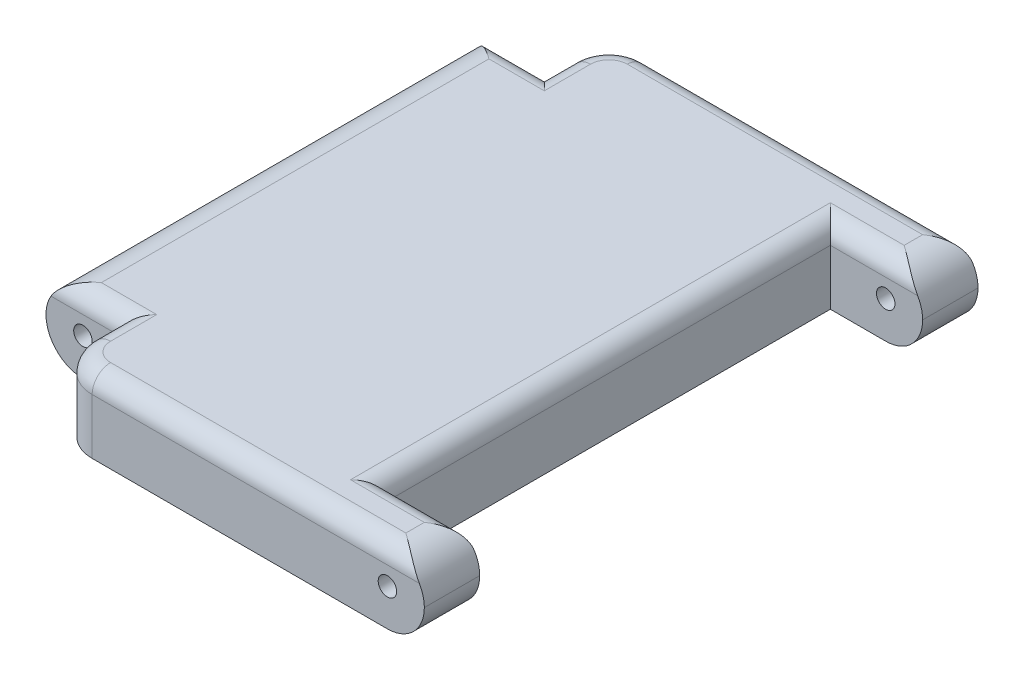
from build123d import *

# Parameters (mm, degrees)
EXTRUDE_1_DEPTH          = 4
CUT_EXTRUDE_1_DEPTH      = 31.6757233
CUT_EXTRUDE_1_DEPTH_BACK = 31.6757233
SKETCH_2_R               = 0.5
CUT_EXTRUDE_2_REACH      = 32.237
SKETCH_3_R               = 0.5
FILLET_1_R               = 2
FILLET_2_R               = 1


# Some blends are built 0.0001 mm under size
with BuildPart() as part:
    # Эскиз1 → Бобышка-Вытянуть1 (new body)
    with BuildSketch(Plane(origin=(0, 0, 0), x_dir=(1, 0, 0), z_dir=(0, 1, 0))):
        Polygon((-10, 15), (10, 15), (10, 12), (5, 12), (5, -12), (10, -12), (10, -15), (-10, -15), (-10, -11.5), (-14, -11.5), (-14, 11.5), (-10, 11.5), align=None)
    extrude(amount=EXTRUDE_1_DEPTH)

    # Эскиз2 → Вырез-Вытянуть1 (cut, two sides: drawn at the far end of the back side and taken through both)
    with BuildSketch(Plane.XY.offset(-12).offset(-CUT_EXTRUDE_1_DEPTH_BACK)):
        with Locations((8, 2)):
            Circle(SKETCH_2_R)
    extrude(amount=CUT_EXTRUDE_1_DEPTH + CUT_EXTRUDE_1_DEPTH_BACK, mode=Mode.SUBTRACT)

    # Эскиз3 → Вырез-Вытянуть2 (cut, up to next)
    with BuildSketch(Plane.XY.offset(11.5), mode=Mode.PRIVATE) as cut_extrude_2_sk1:
        with Locations((-12, 2)):
            Circle(SKETCH_3_R)
    cut_extrude_2_tool1 = extrude(cut_extrude_2_sk1.sketch, amount=-CUT_EXTRUDE_2_REACH, mode=Mode.PRIVATE) & part.part
    add(cut_extrude_2_tool1.solids().sort_by_distance((-12, 2, 11.5))[0], mode=Mode.SUBTRACT)

    # Скругление1
    fillet_1_edges = [part.edges().sort_by_distance(p)[0] for p in [
        (10, 0, -13.5),
        (10, 4, -13.5),
        (10, 0, 13.5),
        (10, 4, 13.5),
        (-14, 0, 0),
        (-14, 4, 0),
        (-10, 2, -15),
        (-10, 2, 15),
    ]]
    fillet(fillet_1_edges, radius=FILLET_1_R - 0.0001)  # a hair under: the kernel refuses the full size

    # Скругление2
    # the kernel refuses this fillet: 1 mm, written as the material it takes off along each edge
    with BuildSketch(Plane(origin=(5, 4, -12), x_dir=(-1, 0, 0), z_dir=(0, 0, 1))) as fillet_2_piece_1:
        with BuildLine():
            CenterArc((FILLET_2_R, FILLET_2_R), FILLET_2_R, 180, 90)
            Line((0, FILLET_2_R), (0, 0))
            Line((0, 0), (FILLET_2_R, 0))
        make_face()
    extrude(amount=24, mode=Mode.SUBTRACT)
    with BuildSketch(Plane(origin=(10.5001, 4, -12), x_dir=(0, 0, -1), z_dir=(-1, 0, 0)), Plane(origin=(5, 4, 12), x_dir=(0, 0, 1), z_dir=(1, 0, 0))) as fillet_2_piece_2:
        with BuildLine():
            CenterArc((FILLET_2_R, FILLET_2_R), FILLET_2_R, 180, 90)
            Line((0, FILLET_2_R), (0, 0))
            Line((0, 0), (FILLET_2_R, 0))
        make_face()
    extrude(amount=5.5001, mode=Mode.SUBTRACT)
    with BuildSketch(Plane(origin=(-14.5001, 4, -11.5), x_dir=(0, 0, 1), z_dir=(1, 0, 0)), Plane(origin=(-10, 4, 11.5), x_dir=(0, 0, -1), z_dir=(-1, 0, 0))) as fillet_2_piece_3:
        with BuildLine():
            CenterArc((FILLET_2_R, FILLET_2_R), FILLET_2_R, 180, 90)
            Line((0, FILLET_2_R), (0, 0))
            Line((0, 0), (FILLET_2_R, 0))
        make_face()
    extrude(amount=4.5001, mode=Mode.SUBTRACT)
    with BuildSketch(Plane(origin=(-10, 4, 13.0001), x_dir=(1, 0, 0), z_dir=(0, 0, -1)), Plane(origin=(-10, 4, -11.5), x_dir=(1, 0, 0), z_dir=(0, 0, -1))) as fillet_2_piece_4:
        with BuildLine():
            CenterArc((FILLET_2_R, FILLET_2_R), FILLET_2_R, 180, 90)
            Line((0, FILLET_2_R), (0, 0))
            Line((0, 0), (FILLET_2_R, 0))
        make_face()
    extrude(amount=1.5001, mode=Mode.SUBTRACT)
    with BuildSketch(Plane(origin=(-8.0001, 4, -15), x_dir=(0, -1, 0), z_dir=(1, 0, 0))) as fillet_2_piece_5:
        with BuildLine():
            CenterArc((FILLET_2_R, -FILLET_2_R), FILLET_2_R, 90, 90)
            Line((0, -FILLET_2_R), (0, 0))
            Line((0, 0), (FILLET_2_R, 0))
        make_face()
    extrude(amount=18.5002, mode=Mode.SUBTRACT)
    with BuildSketch(Plane(origin=(10.5001, 4, 15), x_dir=(0, 0, -1), z_dir=(-1, 0, 0))) as fillet_2_piece_6:
        with BuildLine():
            CenterArc((FILLET_2_R, FILLET_2_R), FILLET_2_R, 180, 90)
            Line((0, FILLET_2_R), (0, 0))
            Line((0, 0), (FILLET_2_R, 0))
        make_face()
    extrude(amount=18.5002, mode=Mode.SUBTRACT)
    with BuildSketch(Plane(origin=(-8.0001, 4, 13.0001), x_dir=(0, 0, 1), z_dir=(1, 0, 0))) as fillet_2_piece_7:
        with BuildLine():
            CenterArc((1.9999 - FILLET_2_R, FILLET_2_R), FILLET_2_R, 270, 90)
            Line((1.9999, FILLET_2_R), (1.9999, 0))
            Line((1.9999, 0), (1.9999 - FILLET_2_R, 0))
        make_face()
    revolve(axis=Axis((-8.0001, 4, 13.0001), (0, -1, 0)), revolution_arc=90, mode=Mode.SUBTRACT)
    with BuildSketch(Plane(origin=(-8.0001, 4, -13.0001), x_dir=(0, 0, -1), z_dir=(1, 0, 0))) as fillet_2_piece_8:
        with BuildLine():
            CenterArc((1.9999 - FILLET_2_R, -FILLET_2_R), FILLET_2_R, 0, 90)
            Line((1.9999 - FILLET_2_R, 0), (1.9999, 0))
            Line((1.9999, 0), (1.9999, -FILLET_2_R))
        make_face()
    revolve(axis=Axis((-8.0001, 4, -13.0001), (0, 1, 0)), revolution_arc=90, mode=Mode.SUBTRACT)
    with BuildSketch(Plane(origin=(10.5001, 4, -12), x_dir=(0, 0, -1), z_dir=(-1, 0, 0))) as fillet_2_piece_9a_section:
        with BuildLine():
            CenterArc((FILLET_2_R, FILLET_2_R), FILLET_2_R, 180, 90)
            Line((0, FILLET_2_R), (0, 0))
            Line((0, 0), (FILLET_2_R, 0))
        make_face()
    fillet_2_piece_9a = extrude(amount=8.0001, mode=Mode.PRIVATE)
    fillet_2_piece_9a = split(fillet_2_piece_9a, bisect_by=Plane(origin=(5, 3.773604886, -12.226395114), z_dir=(-1, 0, 0)), keep=Keep.TOP, mode=Mode.PRIVATE)
    with BuildSketch(Plane(origin=(5, 4, -14.5), x_dir=(-1, 0, 0), z_dir=(0, 0, 1))) as fillet_2_piece_9b_section:
        with BuildLine():
            CenterArc((FILLET_2_R, FILLET_2_R), FILLET_2_R, 180, 90)
            Line((0, FILLET_2_R), (0, 0))
            Line((0, 0), (FILLET_2_R, 0))
        make_face()
    fillet_2_piece_9b = extrude(amount=26.5, mode=Mode.PRIVATE)
    fillet_2_piece_9b = split(fillet_2_piece_9b, bisect_by=Plane(origin=(4.773604886, 3.773604886, -12), z_dir=(0, 0, -1)), keep=Keep.TOP, mode=Mode.PRIVATE)
    fillet_2_piece_9 = fillet_2_piece_9a & fillet_2_piece_9b
    add(fillet_2_piece_9, mode=Mode.SUBTRACT)
    with BuildSketch(Plane(origin=(5, 4, -12), x_dir=(-1, 0, 0), z_dir=(0, 0, 1))) as fillet_2_piece_10a_section:
        with BuildLine():
            CenterArc((FILLET_2_R, FILLET_2_R), FILLET_2_R, 180, 90)
            Line((0, FILLET_2_R), (0, 0))
            Line((0, 0), (FILLET_2_R, 0))
        make_face()
    fillet_2_piece_10a = extrude(amount=26.5, mode=Mode.PRIVATE)
    fillet_2_piece_10a = split(fillet_2_piece_10a, bisect_by=Plane(origin=(4.773604886, 3.773604886, 12), z_dir=(0, 0, 1)), keep=Keep.TOP, mode=Mode.PRIVATE)
    with BuildSketch(Plane(origin=(2.5, 4, 12), x_dir=(0, 0, 1), z_dir=(1, 0, 0))) as fillet_2_piece_10b_section:
        with BuildLine():
            CenterArc((FILLET_2_R, FILLET_2_R), FILLET_2_R, 180, 90)
            Line((0, FILLET_2_R), (0, 0))
            Line((0, 0), (FILLET_2_R, 0))
        make_face()
    fillet_2_piece_10b = extrude(amount=8.0001, mode=Mode.PRIVATE)
    fillet_2_piece_10b = split(fillet_2_piece_10b, bisect_by=Plane(origin=(5, 3.773604886, 12.226395114), z_dir=(-1, 0, 0)), keep=Keep.TOP, mode=Mode.PRIVATE)
    fillet_2_piece_10 = fillet_2_piece_10a & fillet_2_piece_10b
    add(fillet_2_piece_10, mode=Mode.SUBTRACT)
    with BuildSketch(Plane(origin=(-10, 4, -9), x_dir=(1, 0, 0), z_dir=(0, 0, -1))) as fillet_2_piece_11a_section:
        with BuildLine():
            CenterArc((FILLET_2_R, FILLET_2_R), FILLET_2_R, 180, 90)
            Line((0, FILLET_2_R), (0, 0))
            Line((0, 0), (FILLET_2_R, 0))
        make_face()
    fillet_2_piece_11a = extrude(amount=4.0001, mode=Mode.PRIVATE)
    fillet_2_piece_11a = split(fillet_2_piece_11a, bisect_by=Plane(origin=(-9.773604886, 3.773604886, -11.5), z_dir=(0, 0, 1)), keep=Keep.TOP, mode=Mode.PRIVATE)
    with BuildSketch(Plane(origin=(-14.5001, 4, -11.5), x_dir=(0, 0, 1), z_dir=(1, 0, 0))) as fillet_2_piece_11b_section:
        with BuildLine():
            CenterArc((FILLET_2_R, FILLET_2_R), FILLET_2_R, 180, 90)
            Line((0, FILLET_2_R), (0, 0))
            Line((0, 0), (FILLET_2_R, 0))
        make_face()
    fillet_2_piece_11b = extrude(amount=7.0001, mode=Mode.PRIVATE)
    fillet_2_piece_11b = split(fillet_2_piece_11b, bisect_by=Plane(origin=(-10, 3.773604886, -11.273604886), z_dir=(1, 0, 0)), keep=Keep.TOP, mode=Mode.PRIVATE)
    fillet_2_piece_11 = fillet_2_piece_11a & fillet_2_piece_11b
    add(fillet_2_piece_11, mode=Mode.SUBTRACT)
    with BuildSketch(Plane(origin=(-7.5, 4, 11.5), x_dir=(0, 0, -1), z_dir=(-1, 0, 0))) as fillet_2_piece_12a_section:
        with BuildLine():
            CenterArc((FILLET_2_R, FILLET_2_R), FILLET_2_R, 180, 90)
            Line((0, FILLET_2_R), (0, 0))
            Line((0, 0), (FILLET_2_R, 0))
        make_face()
    fillet_2_piece_12a = extrude(amount=7.0001, mode=Mode.PRIVATE)
    fillet_2_piece_12a = split(fillet_2_piece_12a, bisect_by=Plane(origin=(-10, 3.773604886, 11.273604886), z_dir=(1, 0, 0)), keep=Keep.TOP, mode=Mode.PRIVATE)
    with BuildSketch(Plane(origin=(-10, 4, 13.0001), x_dir=(1, 0, 0), z_dir=(0, 0, -1))) as fillet_2_piece_12b_section:
        with BuildLine():
            CenterArc((FILLET_2_R, FILLET_2_R), FILLET_2_R, 180, 90)
            Line((0, FILLET_2_R), (0, 0))
            Line((0, 0), (FILLET_2_R, 0))
        make_face()
    fillet_2_piece_12b = extrude(amount=4.0001, mode=Mode.PRIVATE)
    fillet_2_piece_12b = split(fillet_2_piece_12b, bisect_by=Plane(origin=(-9.773604886, 3.773604886, 11.5), z_dir=(0, 0, -1)), keep=Keep.TOP, mode=Mode.PRIVATE)
    fillet_2_piece_12 = fillet_2_piece_12a & fillet_2_piece_12b
    add(fillet_2_piece_12, mode=Mode.SUBTRACT)


solid = part.part
